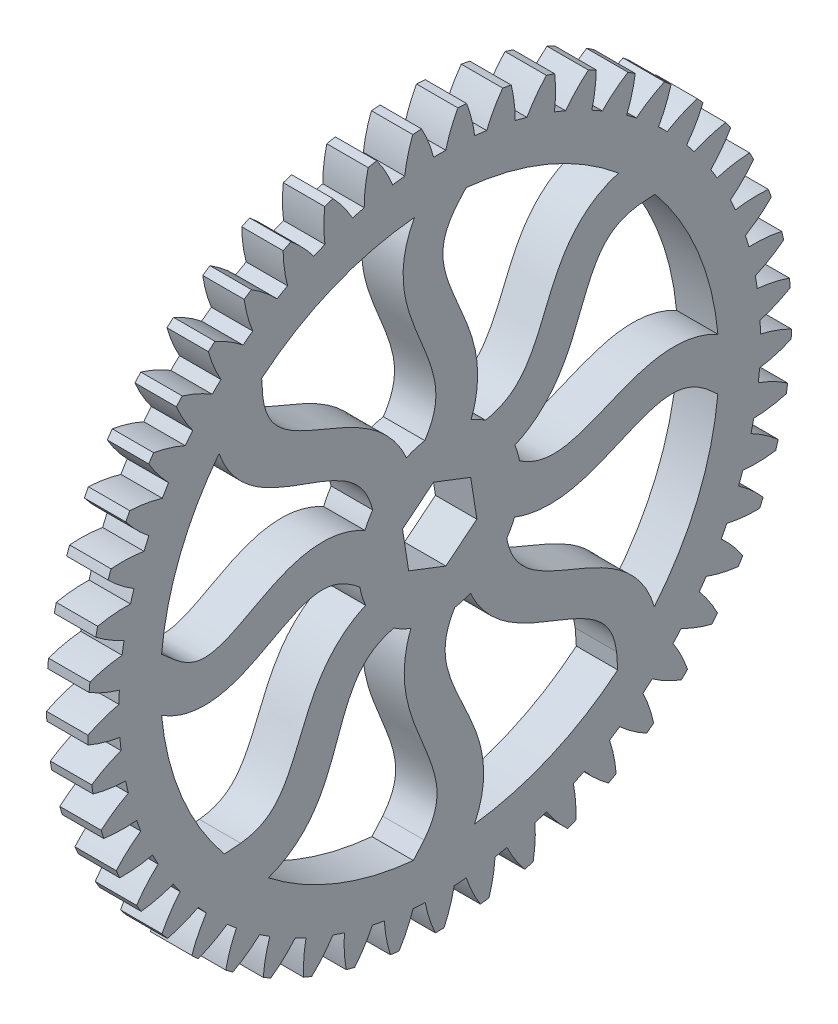
from build123d import *

# Parameters (mm, degrees)
BASPROSKE_W        = 3
BASPROSKE_H        = 25.5
TOOTHCUT_DEPTH     = 37.187014245
TEETHCUTS_COUNT    = 49
TEETHCUTS_ANGLE    = 352.653061224
BORSKE_R           = 1.5
BORE_DEPTH         = 50.0000508
CUT_EXTRUDE1_DEPTH = 10
CUT_EXTRUDE2_DEPTH = 10


with BuildPart() as part:
    # BasProSke → Base-Revolve (revolve)
    with BuildSketch(Plane(origin=(0, 0, 0), x_dir=(1, 0, 0), z_dir=(0, 1, 0))):
        with Locations((1.5, 12.75)):
            Rectangle(BASPROSKE_W, BASPROSKE_H)
    revolve(axis=Axis((-10, 0, 0), (1, 0, 0)))

    # TooCutSke → ToothCut (cut, through all)
    with BuildSketch(Plane(origin=(0, 0, 0), x_dir=(0, 0, -1), z_dir=(1, 0, 0))):
        with BuildLine():
            ThreePointArc((0.438573496, 23.244862966), (0, 23.249), (-0.438573496, 23.244862966))
            ThreePointArc((-0.438573496, 23.244862966), (-0.815537702, 24.39538671), (-1.331491021, 25.490648811))
            ThreePointArc((-1.331491021, 25.490648811), (0, 25.5254), (1.331491021, 25.490648811))
            ThreePointArc((1.331491021, 25.490648811), (0.815537702, 24.39538671), (0.438573496, 23.244862966))
        make_face()
    toothcut = extrude(amount=TOOTHCUT_DEPTH, mode=Mode.SUBTRACT)

    # TeethCuts: ToothCut ×49 about axis
    teethcuts_axis = Axis((-10, 0, 0), (1, 0, 0))
    for i in range(1, TEETHCUTS_COUNT):
        add(toothcut.rotate(teethcuts_axis, i * TEETHCUTS_ANGLE / (TEETHCUTS_COUNT - 1)), mode=Mode.SUBTRACT)

    # BorSke → Bore (cut, symmetric)
    with BuildSketch(Plane(origin=(0, 0, 0), x_dir=(0, 0, -1), z_dir=(1, 0, 0))):
        Circle(BORSKE_R)
    extrude(amount=BORE_DEPTH, both=True, mode=Mode.SUBTRACT)

    # Sketch1 → Cut-Extrude1 (cut)
    with BuildSketch(Plane.ZY):
        with BuildLine():
            add(Edge.make_bspline(
                [(19.262793191, 1.130219505), (19.129321021, 1.013754374), (18.837614244, 0.780833834), (18.33387007, 0.456746396), (17.771497128, 0.216580371), (17.177965053, 0.117475413), (16.364523745, 0.161294773), (15.162964435, 0.56676962), (13.456055365, 1.499088772), (11.518334796, 2.530630983), (9.588473429, 3.130470092), (7.827491281, 3.138811274), (6.563980558, 2.855818277), (5.759260955, 2.497196245), (5.414579936, 2.310014182)],
                knots=[0, 0, 0, 0, 0.03125, 0.0625, 0.125, 0.1875, 0.25, 0.375, 0.5, 0.625, 0.75, 0.8125, 0.875, 0.922533535, 0.922533535, 0.922533535, 0.922533535], degree=3))
            Line((19.262793191, 1.130219505), (20.158543929, 1.911833584))
            ThreePointArc((20.158543929, 1.911833584), (18.823512471, 7.463067684), (15.991930975, 12.420955869))
            add(Edge.make_bspline(
                [(15.991930975, 12.420955869), (15.972794028, 12.366451289), (15.805419978, 11.907573125), (15.199519883, 10.664999075), (13.762956789, 9.181282023), (11.758365855, 8.118722945), (9.772602338, 7.402648207), (7.955158598, 6.746206296), (6.734783089, 6.094870679), (5.980230477, 5.456330658), (5.511057921, 4.894568098), (5.187544939, 4.30921555), (4.982566646, 3.76830469), (4.89544647, 3.460704878), (4.860985596, 3.320340411)],
                knots=[0.059822336, 0.059822336, 0.059822336, 0.059822336, 0.067489668, 0.125, 0.25, 0.375, 0.5, 0.625, 0.75, 0.8125, 0.875, 0.9375, 0.96875, 0.995394723, 0.995394723, 0.995394723, 0.995394723], degree=3))
            ThreePointArc((4.860985596, 3.320340411), (5.162557654, 2.828752354), (5.414579936, 2.310014182))
        make_face()
        with BuildLine():
            ThreePointArc((15.606113603, -12.902372619), (18.703315076, -7.759381816), (20.156400389, -1.934302037))
            add(Edge.make_bspline(
                [(20.156400389, -1.934302037), (20.093289022, -1.973449139), (19.602185546, -2.267527456), (18.216858359, -2.876479281), (16.011429406, -2.935946236), (13.832806358, -2.130680587), (11.965353241, -1.101359946), (10.276020203, -0.217804379), (9.051554059, 0.131508716), (8.156867604, 0.130300539), (7.461893704, -0.021358716), (6.79678896, -0.331731433), (6.230828291, -0.70934804), (5.92342141, -0.955059029), (5.788624939, -1.070356355)],
                knots=[0.053260293, 0.053260293, 0.053260293, 0.053260293, 0.0625, 0.125, 0.25, 0.375, 0.5, 0.625, 0.75, 0.8125, 0.875, 0.9375, 0.96875, 0.995511359, 0.995511359, 0.995511359, 0.995511359], degree=3))
            ThreePointArc((5.788624939, -1.070356355), (5.618968067, -1.755288942), (5.368576288, -2.415001046))
            add(Edge.make_bspline(
                [(14.420037566, -12.821665814), (14.258189896, -12.802582027), (13.922878054, -12.748548533), (13.367934141, -12.60414959), (12.793176239, -12.358778044), (12.242896665, -11.97732605), (11.603754758, -11.33096641), (10.914570879, -10.212484305), (10.179174022, -8.456737366), (9.370909844, -6.492732884), (8.219935596, -4.496445665), (6.766204061, -3.121340118), (5.669897551, -2.547490328), (5.368576288, -2.415001046)],
                knots=[0, 0, 0, 0, 0.03125, 0.0625, 0.125, 0.1875, 0.25, 0.375, 0.5, 0.625, 0.75, 0.875, 0.919025722, 0.919025722, 0.919025722, 0.919025722], degree=3))
            Line((14.420037566, -12.821665814), (15.606113603, -12.902372619))
        make_face()
        with BuildLine():
            Line((12.821665814, 14.420037566), (12.902372619, 15.606113603))
            ThreePointArc((12.902372619, 15.606113603), (12.007033031, 16.305004103), (11.073914875, 16.952593027))
            ThreePointArc((11.073914875, 16.952593027), (6.651393384, 19.125401095), (1.835004143, 20.165682751))
            add(Edge.make_bspline(
                [(1.835004143, 20.165682751), (1.839017106, 20.158313673), (1.871102028, 20.09915089), (2.10228834, 19.658168164), (2.6137738, 18.372708509), (2.744074954, 16.31160409), (2.180566354, 14.113906508), (1.373491484, 12.163355322), (0.635613775, 10.377423011), (0.29585353, 9.036483995), (0.260181391, 8.048652784), (0.359821937, 7.323551534), (0.574953439, 6.690292747), (0.836552271, 6.175501551), (1.004632225, 5.905084457), (1.084565861, 5.785979459)],
                knots=[0.058565411, 0.058565411, 0.058565411, 0.058565411, 0.059677168, 0.067489668, 0.125, 0.25, 0.375, 0.5, 0.625, 0.75, 0.8125, 0.875, 0.9375, 0.96875, 0.995186437, 0.995186437, 0.995186437, 0.995186437], degree=3))
            ThreePointArc((1.084565861, 5.785979459), (1.762185713, 5.616808963), (2.415001046, 5.368576288))
            add(Edge.make_bspline(
                [(12.821665814, 14.420037566), (12.802582027, 14.258189896), (12.748548533, 13.922878054), (12.60414959, 13.367934141), (12.358778044, 12.793176239), (11.97732605, 12.242896665), (11.33096641, 11.603754758), (10.212484305, 10.914570879), (8.456737366, 10.179174022), (6.492732884, 9.370909844), (4.496445665, 8.219935596), (3.121340118, 6.766204061), (2.547490328, 5.669897551), (2.415001046, 5.368576288)],
                knots=[0, 0, 0, 0, 0.03125, 0.0625, 0.125, 0.1875, 0.25, 0.375, 0.5, 0.625, 0.75, 0.875, 0.919025722, 0.919025722, 0.919025722, 0.919025722], degree=3))
        make_face()
        with BuildLine():
            ThreePointArc((1.911833584, -20.158543929), (7.463067684, -18.823512471), (12.420955869, -15.991930975))
            add(Edge.make_bspline(
                [(12.420955869, -15.991930975), (12.366451289, -15.972794028), (11.907573125, -15.805419978), (10.664999075, -15.199519883), (9.181282023, -13.762956789), (8.118722945, -11.758365855), (7.402648207, -9.772602338), (6.746206296, -7.955158598), (6.094870679, -6.734783089), (5.456330658, -5.980230477), (4.894568098, -5.511057921), (4.30921555, -5.187544939), (3.76830469, -4.982566646), (3.460704878, -4.89544647), (3.320340411, -4.860985596)],
                knots=[0.059822336, 0.059822336, 0.059822336, 0.059822336, 0.067489668, 0.125, 0.25, 0.375, 0.5, 0.625, 0.75, 0.8125, 0.875, 0.9375, 0.96875, 0.995394723, 0.995394723, 0.995394723, 0.995394723], degree=3))
            ThreePointArc((3.320340411, -4.860985596), (2.723449845, -5.218875583), (2.088493082, -5.503820315))
            add(Edge.make_bspline(
                [(1.130219505, -19.262793191), (1.029270195, -19.134855331), (0.830376368, -18.859546604), (0.540077236, -18.365036528), (0.30716591, -17.785117433), (0.187786783, -17.126283724), (0.192890491, -16.217296863), (0.496450177, -14.939083987), (1.21794664, -13.177579316), (2.035178446, -11.217289347), (2.63290498, -8.991839421), (2.577308011, -6.991549538), (2.207875321, -5.810570693), (2.088493082, -5.503820315)],
                knots=[0, 0, 0, 0, 0.03125, 0.0625, 0.125, 0.1875, 0.25, 0.375, 0.5, 0.625, 0.75, 0.875, 0.919025722, 0.919025722, 0.919025722, 0.919025722], degree=3))
            Line((1.130219505, -19.262793191), (1.911833584, -20.158543929))
        make_face()
        with BuildLine():
            Line((-1.130219505, 19.262793191), (-1.911833584, 20.158543929))
            ThreePointArc((-1.911833584, 20.158543929), (-4.156853186, 19.81773379), (-6.349597947, 19.227704151))
            ThreePointArc((-6.349597947, 19.227704151), (-9.828572257, 17.703704934), (-12.961747147, 15.556834893))
            add(Edge.make_bspline(
                [(-12.961747147, 15.556834893), (-12.953698829, 15.554461762), (-12.889176958, 15.535314823), (-12.413881673, 15.386966356), (-11.143249596, 14.839683954), (-9.593691857, 13.474399872), (-8.438145745, 11.521932257), (-7.629585888, 9.571996172), (-6.888499372, 7.787392993), (-6.180559074, 6.598959148), (-5.507280937, 5.875232989), (-4.924100421, 5.432965484), (-4.324197894, 5.137304845), (-3.775207241, 4.958270808), (-3.465143004, 4.885907521), (-3.324401436, 4.858209186)],
                knots=[0.058565411, 0.058565411, 0.058565411, 0.058565411, 0.059677168, 0.067489668, 0.125, 0.25, 0.375, 0.5, 0.625, 0.75, 0.8125, 0.875, 0.9375, 0.96875, 0.995186437, 0.995186437, 0.995186437, 0.995186437], degree=3))
            ThreePointArc((-3.324401436, 4.858209186), (-2.814702053, 5.1702315), (-2.275993628, 5.42896808))
            add(Edge.make_bspline(
                [(-1.130219505, 19.262793191), (-1.031352103, 19.133239743), (-0.836935922, 18.854750966), (-0.554670796, 18.355611507), (-0.331167006, 17.772002136), (-0.222456594, 17.111324242), (-0.24225763, 16.202538745), (-0.566445879, 14.929401431), (-1.316330921, 13.179793397), (-2.165153077, 11.232974059), (-2.798786202, 9.017480109), (-2.775194024, 6.986730822), (-2.406862414, 5.768192096), (-2.275993628, 5.42896808)],
                knots=[0, 0, 0, 0, 0.03125, 0.0625, 0.125, 0.1875, 0.25, 0.375, 0.5, 0.625, 0.75, 0.875, 0.923407897, 0.923407897, 0.923407897, 0.923407897], degree=3))
        make_face()
        with BuildLine():
            ThreePointArc((-2.621798098, -20.07855014), (-2.573436867, -20.084805792), (-2.525060713, -20.09094496))
            add(Edge.make_bspline(
                [(-2.525060713, -20.09094496), (-2.550069406, -20.038872537), (-2.756193941, -19.59604535), (-3.206390413, -18.288976747), (-3.239733296, -16.224026853), (-2.573616183, -14.055224281), (-1.675810637, -12.144736129), (-0.854858371, -10.395434809), (-0.452486404, -9.07193518), (-0.370453114, -8.086869932), (-0.435924134, -7.357888721), (-0.621072667, -6.715223741), (-0.858612864, -6.187800463), (-1.014515509, -5.908691283), (-1.089400658, -5.785071099)],
                knots=[0.059822336, 0.059822336, 0.059822336, 0.059822336, 0.067489668, 0.125, 0.25, 0.375, 0.5, 0.625, 0.75, 0.8125, 0.875, 0.9375, 0.96875, 0.995394723, 0.995394723, 0.995394723, 0.995394723], degree=3))
            ThreePointArc((-1.089400658, -5.785071099), (-1.667969883, -5.645504218), (-2.229489616, -5.448230673))
            add(Edge.make_bspline(
                [(-12.821665814, -14.420037566), (-12.799967503, -14.258519634), (-12.740519199, -13.924125332), (-12.587165888, -13.371588851), (-12.33253279, -12.800873661), (-11.94223284, -12.256833973), (-11.285623006, -11.628227032), (-10.156143269, -10.957218713), (-8.388734766, -10.250307806), (-6.411917707, -9.473906553), (-4.397280631, -8.355362037), (-2.978006229, -6.902723256), (-2.376819012, -5.78063648), (-2.229489616, -5.448230673)],
                knots=[0, 0, 0, 0, 0.03125, 0.0625, 0.125, 0.1875, 0.25, 0.375, 0.5, 0.625, 0.75, 0.875, 0.923407897, 0.923407897, 0.923407897, 0.923407897], degree=3))
            Line((-12.821665814, -14.420037566), (-12.902372619, -15.606113603))
            ThreePointArc((-12.902372619, -15.606113603), (-8.077786903, -18.568019812), (-2.621798098, -20.07855014))
        make_face()
        with BuildLine():
            Line((-14.420037566, 12.821665814), (-15.606113603, 12.902372619))
            ThreePointArc((-15.606113603, 12.902372619), (-17.546842822, 10.105954085), (-18.991734007, 7.023961875))
            ThreePointArc((-18.991734007, 7.023961875), (-19.749864363, 4.468205304), (-20.165682751, 1.835004143))
            add(Edge.make_bspline(
                [(-20.165682751, 1.835004143), (-20.158313673, 1.839017106), (-20.09915089, 1.871102028), (-19.658168164, 2.10228834), (-18.372708509, 2.6137738), (-16.31160409, 2.744074954), (-14.113906508, 2.180566354), (-12.163355322, 1.373491484), (-10.377423011, 0.635613775), (-9.036483995, 0.29585353), (-8.048652784, 0.260181391), (-7.323551534, 0.359821937), (-6.690292747, 0.574953439), (-6.175501551, 0.836552271), (-5.905084457, 1.004632225), (-5.785979459, 1.084565861)],
                knots=[0.058565411, 0.058565411, 0.058565411, 0.058565411, 0.059677168, 0.067489668, 0.125, 0.25, 0.375, 0.5, 0.625, 0.75, 0.8125, 0.875, 0.9375, 0.96875, 0.995186437, 0.995186437, 0.995186437, 0.995186437], degree=3))
            ThreePointArc((-5.785979459, 1.084565861), (-5.646200663, 1.665610845), (-5.448230673, 2.229489616))
            add(Edge.make_bspline(
                [(-14.420037566, 12.821665814), (-14.258519634, 12.799967503), (-13.924125332, 12.740519199), (-13.371588851, 12.587165888), (-12.800873661, 12.33253279), (-12.256833973, 11.94223284), (-11.628227032, 11.285623006), (-10.957218713, 10.156143269), (-10.250307806, 8.388734766), (-9.473906553, 6.411917707), (-8.355362037, 4.397280631), (-6.902723256, 2.978006229), (-5.78063648, 2.376819012), (-5.448230673, 2.229489616)],
                knots=[0, 0, 0, 0, 0.03125, 0.0625, 0.125, 0.1875, 0.25, 0.375, 0.5, 0.625, 0.75, 0.875, 0.923407897, 0.923407897, 0.923407897, 0.923407897], degree=3))
        make_face()
        with BuildLine():
            ThreePointArc((-17.332706998, -10.468966955), (-16.49193681, -11.748958306), (-15.556834893, -12.961747147))
            add(Edge.make_bspline(
                [(-15.556834893, -12.961747147), (-15.554461762, -12.953698829), (-15.535314823, -12.889176958), (-15.386966356, -12.413881673), (-14.839683954, -11.143249596), (-13.474399872, -9.593691857), (-11.521932257, -8.438145745), (-9.571996172, -7.629585888), (-7.787392993, -6.888499372), (-6.598959148, -6.180559074), (-5.875232989, -5.507280937), (-5.432965484, -4.924100421), (-5.137304845, -4.324197894), (-4.958270808, -3.775207241), (-4.885907521, -3.465143004), (-4.858209186, -3.324401436)],
                knots=[0.058565411, 0.058565411, 0.058565411, 0.058565411, 0.059677168, 0.067489668, 0.125, 0.25, 0.375, 0.5, 0.625, 0.75, 0.8125, 0.875, 0.9375, 0.96875, 0.995186437, 0.995186437, 0.995186437, 0.995186437], degree=3))
            ThreePointArc((-4.858209186, -3.324401436), (-5.1702315, -2.814702053), (-5.42896808, -2.275993628))
            add(Edge.make_bspline(
                [(-19.262793191, -1.130219505), (-19.133239743, -1.031352103), (-18.854750966, -0.836935922), (-18.355611507, -0.554670796), (-17.772002136, -0.331167006), (-17.111324242, -0.222456594), (-16.202538745, -0.24225763), (-14.929401431, -0.566445879), (-13.179793397, -1.316330921), (-11.232974059, -2.165153077), (-9.017480109, -2.798786202), (-6.986730822, -2.775194024), (-5.768192096, -2.406862414), (-5.42896808, -2.275993628)],
                knots=[0, 0, 0, 0, 0.03125, 0.0625, 0.125, 0.1875, 0.25, 0.375, 0.5, 0.625, 0.75, 0.875, 0.923407897, 0.923407897, 0.923407897, 0.923407897], degree=3))
            Line((-19.262793191, -1.130219505), (-20.158543929, -1.911833584))
            ThreePointArc((-20.158543929, -1.911833584), (-19.227704151, -6.349597947), (-17.332706998, -10.468966955))
        make_face()
    extrude(amount=-CUT_EXTRUDE1_DEPTH, mode=Mode.SUBTRACT)

    # Sketch2 → Cut-Extrude2 (cut)
    with BuildSketch(Plane.ZY):
        Polygon((2.692834112, 1.040181609), (0.445593358, 2.852153554), (-2.247240754, 1.811971944), (-2.692834112, -1.040181609), (-0.445593358, -2.852153554), (2.247240754, -1.811971944), align=None)
    extrude(amount=-CUT_EXTRUDE2_DEPTH, mode=Mode.SUBTRACT)


solid = part.part
